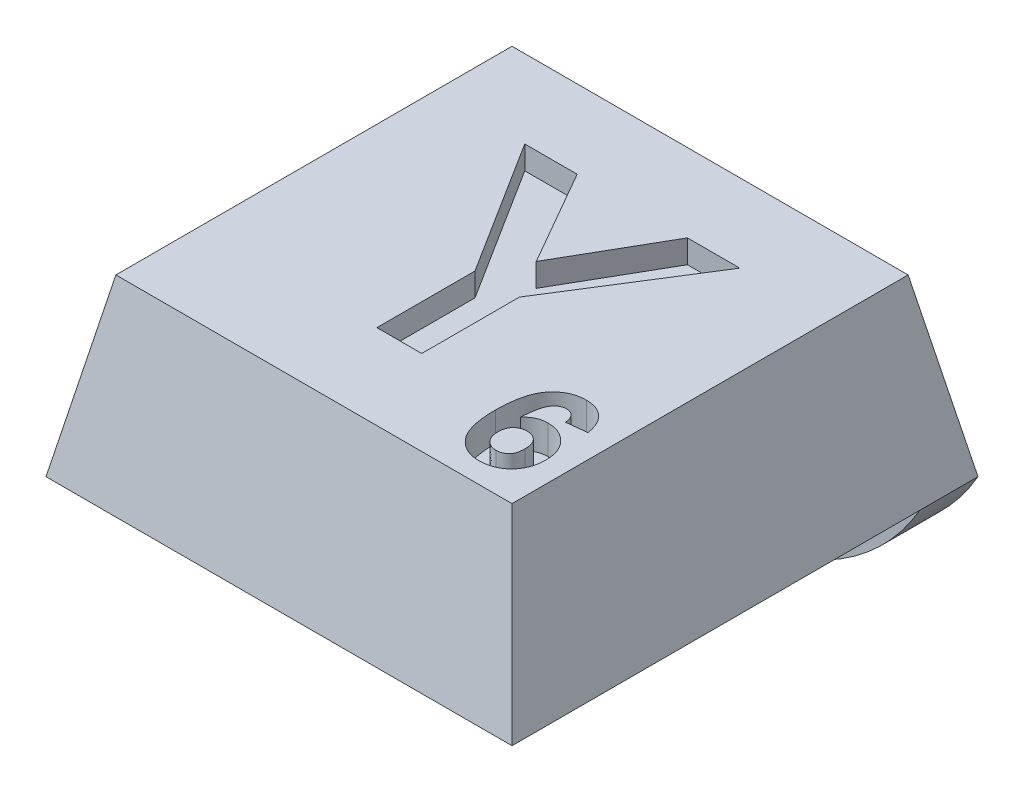
from build123d import *

# Parameters (mm, degrees)
SKETCH1_W               = 8
SKETCH1_H               = 8
BOSS_EXTRUDE1_DEPTH     = 3
CUT_EXTRUDE1_DEPTH      = 12.704699911
CUT_EXTRUDE1_DEPTH_BACK = 12.704699911
CUT_EXTRUDE2_DEPTH      = 11
SKETCH4_R               = 1.75
CUT_EXTRUDE3_DEPTH      = 0.4
SKETCH5_W               = 8
SKETCH5_H               = 1
BOSS_EXTRUDE2_DEPTH     = 2
FILLET1_R               = 4
CUT_EXTRUDE4_DEPTH      = 0.4
CUT_EXTRUDE5_DEPTH      = 0.5


with BuildPart() as part:
    # Sketch1 → Boss-Extrude1 (new body)
    with BuildSketch(Plane(origin=(0, 0, 0), x_dir=(1, 0, 0), z_dir=(0, 1, 0))):
        with Locations((4, 4)):
            Rectangle(SKETCH1_W, SKETCH1_H)
    extrude(amount=BOSS_EXTRUDE1_DEPTH)

    # Sketch2 → Cut-Extrude1 (cut, two sides: drawn at the far end of the back side and taken through both)
    with BuildSketch(Plane.XY.offset(-CUT_EXTRUDE1_DEPTH_BACK)):
        Polygon((0, 0), (0.6, 3), (0, 3), align=None)
        Polygon((8, 0), (7.4, 3), (8, 3), align=None)
    extrude(amount=CUT_EXTRUDE1_DEPTH + CUT_EXTRUDE1_DEPTH_BACK, mode=Mode.SUBTRACT)

    # Sketch3 → Cut-Extrude2 (cut)
    with BuildSketch(Plane(origin=(0, 0, 0), x_dir=(0, 0, -1), z_dir=(1, 0, 0))):
        Polygon((0, 0), (0.6, 3), (0, 3), align=None)
        Polygon((8, 3), (7.4, 3), (8, 0), align=None)
    extrude(amount=CUT_EXTRUDE2_DEPTH, mode=Mode.SUBTRACT)

    # Sketch4 → Cut-Extrude3 (cut)
    with BuildSketch(Plane.XZ):
        with Locations(Location((4, -3.75, 0), (0, 0, 270))):
            Circle(SKETCH4_R)
    extrude(amount=-CUT_EXTRUDE3_DEPTH, mode=Mode.SUBTRACT)

    # Sketch5 → Boss-Extrude2 (add)
    with BuildSketch(Plane.XZ):
        with Locations((4, -7.5)):
            Rectangle(SKETCH5_W, SKETCH5_H)
    extrude(amount=BOSS_EXTRUDE2_DEPTH)

    # Fillet1
    # the kernel refuses this fillet: 4 mm, written as the material it takes off along each edge
    with BuildSketch(Plane(origin=(8, -2, -16.660254038), x_dir=(0, 1, 0), z_dir=(0, 0, 1)), Plane(origin=(0, -2, 1.660254038), x_dir=(0, 1, 0), z_dir=(0, 0, -1))) as fillet1_piece_1:
        with BuildLine():
            CenterArc((4, 3.464101615), FILLET1_R, 180, 60)
            Line((0, 3.464101615), (-0.08, 3.464101615))
            Line((-0.08, 3.464101615), (-0.08, 0))
            Line((-0.08, 0), (0, -0.08))
            ThreePointArc((0, -0.08), (1, -0.08), (1.96, -0.069282032))
            Line((1.96, -0.069282032), (2, 0))
        make_face()
    extrude(amount=18.320508076, mode=Mode.SUBTRACT)

    # Sketch6 → Cut-Extrude4 (cut)
    with BuildSketch(Plane(origin=(0, 3, 0), x_dir=(1, 0, 0), z_dir=(0, 1, 0))):
        Polygon((3.623842243, 2.056832464), (3.623842243, 3.740326053), (2.162303782, 6.056832464), (3.062143525, 6.056832464), (4.007656346, 4.408595284), (4.95477173, 6.056832464), (5.854611474, 6.056832464), (4.393073013, 3.734717079), (4.393073013, 2.056832464), align=None)
    extrude(amount=-CUT_EXTRUDE4_DEPTH, mode=Mode.SUBTRACT)

    # Sketch7 → Cut-Extrude5 (cut)
    with BuildSketch(Plane(origin=(0, 3, 0), x_dir=(1, 0, 0), z_dir=(0, 1, 0))):
        with BuildLine():
            Line((6.99657775, 2.307478491), (6.650423904, 2.269617914))
            add(Edge.make_bspline(
                [(6.650423904, 2.269617914), (6.648104786, 2.286290214), (6.643740629, 2.317664439), (6.630814222, 2.360960848), (6.6128192, 2.397384178), (6.589720846, 2.426985356), (6.562208273, 2.449767653), (6.53085918, 2.465955864), (6.495693494, 2.475565581), (6.471038508, 2.476713937), (6.458236404, 2.477310221)],
                knots=[0, 0, 0, 0, 1.280716388, 2.410074291, 3.425374506, 4.35753932, 5.248331359, 6.12451615, 7.026154803, 8, 8, 8, 8], degree=3))
            add(Edge.make_bspline(
                [(6.458236404, 2.477310221), (6.449554942, 2.477097941), (6.432279271, 2.476675513), (6.407115159, 2.471312362), (6.382853927, 2.463353411), (6.359693582, 2.452081234), (6.337518567, 2.437536581), (6.316665994, 2.419545601), (6.296177185, 2.39905664), (6.277258092, 2.37431526), (6.259107425, 2.34501973), (6.243478966, 2.309156475), (6.229549311, 2.266758815), (6.217622545, 2.217619097), (6.206799126, 2.162049229), (6.197926997, 2.099824257), (6.190827571, 2.030888275), (6.1874217, 1.982610246), (6.18564025, 1.957358298)],
                knots=[0, 0, 0, 0, 0.642458078, 1.278459126, 1.898279436, 2.531842133, 3.181731979, 3.858193002, 4.57010051, 5.325711302, 6.161524323, 7.118599443, 8.217371811, 9.466325973, 10.864147948, 12.412648259, 14.123626419, 16, 16, 16, 16], degree=3))
            add(Edge.make_bspline(
                [(6.18564025, 1.957358298), (6.196703374, 1.969374309), (6.218396997, 1.992936442), (6.254393564, 2.023656049), (6.292105324, 2.049919261), (6.331942634, 2.071465901), (6.374122941, 2.087500286), (6.417882183, 2.099674887), (6.463793169, 2.1064945), (6.494994081, 2.107544715), (6.510880634, 2.108079452)],
                knots=[0, 0, 0, 0, 1.057745406, 2.074127497, 3.059409796, 4.031705469, 5.000875988, 5.977809597, 6.970362319, 8, 8, 8, 8], degree=3))
            add(Edge.make_bspline(
                [(6.510880634, 2.108079452), (6.528809934, 2.107563089), (6.564213931, 2.106543456), (6.616372239, 2.099391957), (6.666421561, 2.086532277), (6.714588312, 2.069136373), (6.761110551, 2.047230594), (6.805098359, 2.019501147), (6.847242227, 1.987169858), (6.886962554, 1.950231753), (6.923455982, 1.909566001), (6.95567607, 1.865643773), (6.982192143, 1.818330938), (7.00486021, 1.76868676), (7.021726117, 1.715731209), (7.033968982, 1.660226315), (7.04127711, 1.601662587), (7.042239139, 1.561706039), (7.042731596, 1.541252529)],
                knots=[0, 0, 0, 0, 0.99135015, 1.957564468, 2.903754199, 3.843479786, 4.78583385, 5.741106244, 6.712813504, 7.719198368, 8.735844933, 9.730198001, 10.724351158, 11.729813921, 12.742848014, 13.790983496, 14.86921809, 16, 16, 16, 16], degree=3))
            add(Edge.make_bspline(
                [(7.042731596, 1.541252529), (7.042231952, 1.519599685), (7.041257525, 1.477371451), (7.034085066, 1.415527203), (7.021415455, 1.357153196), (7.004106031, 1.301781092), (6.981716795, 1.249849655), (6.954594052, 1.200930916), (6.921819947, 1.155860856), (6.884881845, 1.114033218), (6.84370317, 1.076707467), (6.799818397, 1.043655074), (6.752740779, 1.016179585), (6.703166183, 0.993054256), (6.650243128, 0.9760833), (6.594904638, 0.963355935), (6.536700741, 0.955593381), (6.496962304, 0.954693712), (6.476625827, 0.954233298)],
                knots=[0, 0, 0, 0, 1.13287417, 2.209376133, 3.25169942, 4.254157582, 5.240146322, 6.205890558, 7.174579019, 8.150183866, 9.1206468, 10.07783463, 11.019441811, 11.967766696, 12.934309213, 13.921380422, 14.936249089, 16, 16, 16, 16], degree=3))
            add(Edge.make_bspline(
                [(6.476625827, 0.954233298), (6.454835686, 0.954842926), (6.411992392, 0.956041562), (6.349274568, 0.965905733), (6.289647802, 0.982594351), (6.233119501, 1.005900716), (6.179219819, 1.035216515), (6.128449255, 1.071632083), (6.080942348, 1.114800151), (6.036070744, 1.164136126), (5.995238787, 1.221123075), (5.960465944, 1.286988003), (5.930975089, 1.361009558), (5.906965213, 1.443377578), (5.888431321, 1.534085529), (5.875498792, 1.633141016), (5.86690889, 1.740380226), (5.866183985, 1.814672002), (5.865808519, 1.853151567)],
                knots=[0, 0, 0, 0, 0.852151446, 1.675481364, 2.476404467, 3.269281233, 4.062617998, 4.871616733, 5.707301388, 6.56955125, 7.476395267, 8.442009786, 9.475854496, 10.58877921, 11.794095973, 13.094195288, 14.494932947, 16, 16, 16, 16], degree=3))
            add(Edge.make_bspline(
                [(5.865808519, 1.853151567), (5.866346697, 1.892590697), (5.867386586, 1.968796599), (5.875754473, 2.078827487), (5.889046125, 2.180436336), (5.908408745, 2.273394012), (5.933175033, 2.357893394), (5.963200156, 2.434104295), (5.99923844, 2.501750812), (6.041138584, 2.560612949), (6.087240817, 2.61177964), (6.136777869, 2.655945181), (6.189560624, 2.693536639), (6.245587817, 2.724459089), (6.305319384, 2.747901225), (6.368188753, 2.764829378), (6.434301522, 2.775708833), (6.479587723, 2.776770851), (6.502587365, 2.777310221)],
                knots=[0, 0, 0, 0, 1.491699013, 2.882321987, 4.171520357, 5.365488089, 6.470299549, 7.49861535, 8.458736801, 9.361983288, 10.224742848, 11.058789056, 11.867429157, 12.671146298, 13.473202851, 14.288259215, 15.130652936, 16, 16, 16, 16], degree=3))
            add(Edge.make_bspline(
                [(6.502587365, 2.777310221), (6.518832845, 2.777017956), (6.550590682, 2.776446616), (6.597136362, 2.770379458), (6.641540508, 2.76110179), (6.683919501, 2.748259344), (6.723974963, 2.731060825), (6.761865954, 2.710109046), (6.797719857, 2.685460752), (6.831350121, 2.657274635), (6.862486078, 2.625465393), (6.890601127, 2.589961055), (6.915881459, 2.551190115), (6.938437714, 2.509184749), (6.957357529, 2.46354265), (6.973622233, 2.414622738), (6.98699882, 2.362319913), (6.993336088, 2.326037695), (6.99657775, 2.307478491)],
                knots=[0, 0, 0, 0, 1.036027791, 2.025301876, 2.989435482, 3.928225244, 4.845595412, 5.765526461, 6.686607585, 7.61747015, 8.561102691, 9.521661062, 10.50224679, 11.510949117, 12.559251378, 13.650572309, 14.798212656, 16, 16, 16, 16], degree=3))
        make_face()
        with BuildLine():
            add(Edge.make_bspline(
                [(6.211962365, 1.549185221), (6.212093793, 1.537753077), (6.212350595, 1.515415322), (6.216561681, 1.483001611), (6.222614755, 1.452614338), (6.230767911, 1.42408476), (6.242068736, 1.397844656), (6.255476173, 1.373367715), (6.271335314, 1.350875727), (6.295669246, 1.324486058), (6.329294099, 1.29676891), (6.373421783, 1.272086886), (6.420703408, 1.256744198), (6.453316703, 1.255075433), (6.469774865, 1.254233298)],
                knots=[0, 0, 0, 0, 0.93816693, 1.833124408, 2.679057427, 3.481731691, 4.264557977, 5.020023694, 5.770442996, 6.518065735, 7.962605608, 9.32780964, 10.651490302, 12, 12, 12, 12], degree=3))
            add(Edge.make_bspline(
                [(6.469774865, 1.254233298), (6.485365796, 1.254933043), (6.51571185, 1.256295021), (6.559046727, 1.268742487), (6.598409917, 1.288373431), (6.627266187, 1.311420354), (6.647387039, 1.333836313), (6.660907792, 1.353494474), (6.671913698, 1.375919542), (6.680911589, 1.400742183), (6.688159323, 1.427866383), (6.693107691, 1.457564676), (6.69591447, 1.48975573), (6.696351403, 1.512040132), (6.69657775, 1.52358426)],
                knots=[0, 0, 0, 0, 1.399678333, 2.724321989, 4.020062797, 5.33532049, 6.016755754, 6.724441967, 7.473839083, 8.257094862, 9.096253071, 9.995581596, 10.961638663, 12, 12, 12, 12], degree=3))
            add(Edge.make_bspline(
                [(6.69657775, 1.52358426), (6.696384678, 1.535490976), (6.696011412, 1.558510238), (6.692745041, 1.591780733), (6.687401372, 1.622537963), (6.679930507, 1.650999261), (6.669817892, 1.676783929), (6.657887501, 1.700412041), (6.643402955, 1.721242874), (6.621876525, 1.745742616), (6.590576263, 1.770429427), (6.548753213, 1.792915191), (6.501874013, 1.805662518), (6.469248141, 1.807258544), (6.452467173, 1.808079452)],
                knots=[0, 0, 0, 0, 1.008384627, 1.949510571, 2.828269698, 3.650667555, 4.437180943, 5.170285793, 5.887596972, 6.580056709, 7.926803404, 9.238379296, 10.579573008, 12, 12, 12, 12], degree=3))
            add(Edge.make_bspline(
                [(6.452467173, 1.808079452), (6.436151813, 1.807414866), (6.404464825, 1.806124136), (6.358926875, 1.793162443), (6.31725918, 1.772538153), (6.286568407, 1.748308757), (6.264936989, 1.725473324), (6.25076935, 1.706030549), (6.238437114, 1.684862342), (6.228698053, 1.661421349), (6.221189386, 1.636147459), (6.215803903, 1.608867965), (6.212544961, 1.579673333), (6.212160051, 1.559530412), (6.211962365, 1.549185221)],
                knots=[0, 0, 0, 0, 1.469034193, 2.853094746, 4.235454457, 5.641396914, 6.354997179, 7.06867986, 7.807229614, 8.560602297, 9.353235934, 10.182779392, 11.06669468, 12, 12, 12, 12], degree=3))
        make_face(mode=Mode.SUBTRACT)
    extrude(amount=-CUT_EXTRUDE5_DEPTH, mode=Mode.SUBTRACT)


solid = part.part
